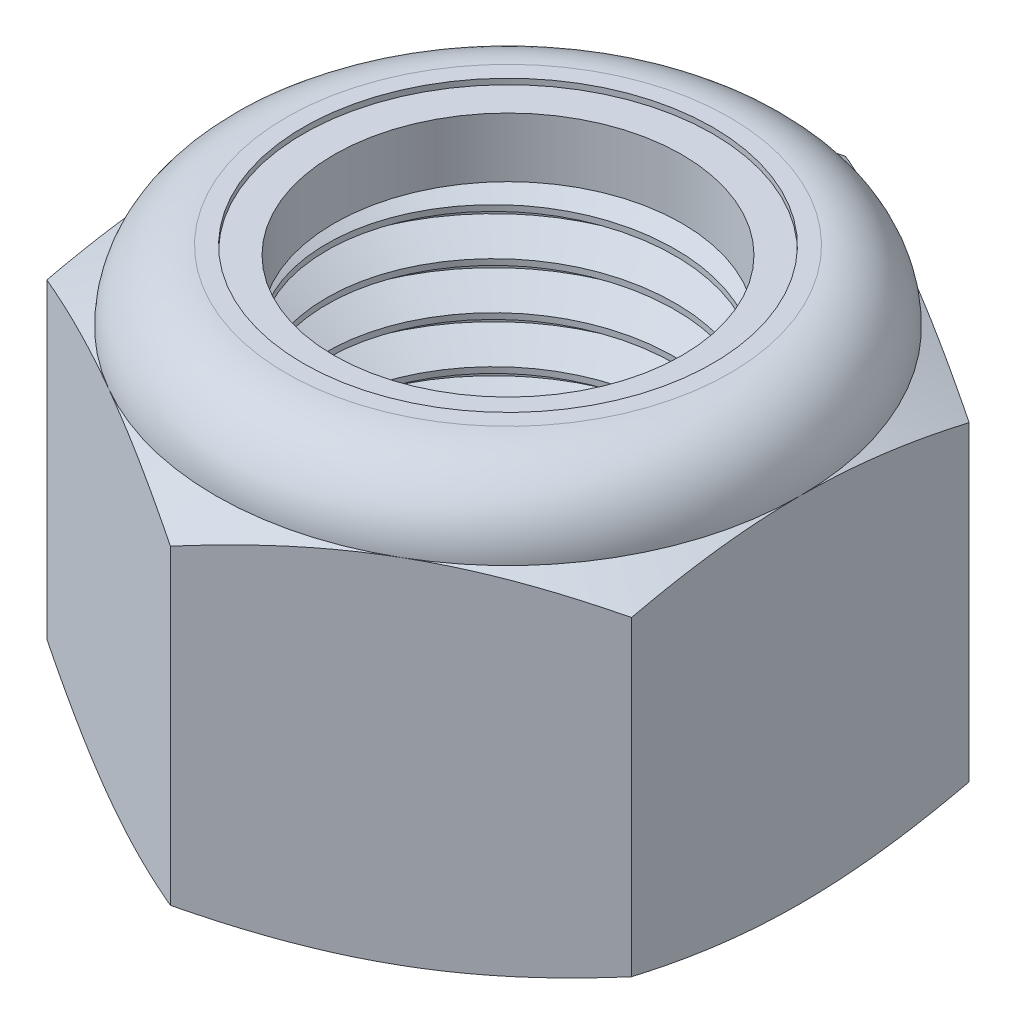
from build123d import *

# Parameters (mm, degrees)
SKETCH1_R        = 5.55625
EXTRUDE1_DEPTH   = 11.509375
SKETCH2_W        = 5.55625
SKETCH2_H        = 9.591145833
CUT_SWEEP1_PITCH = 1.27
SKETCH12_W       = 6.111875
SKETCH12_H       = 9.591145833


with BuildPart() as part:
    # Sketch1 → Extrude1 (new body)
    with BuildSketch(Plane(origin=(0, 0, 0), x_dir=(1, 0, 0), z_dir=(0, 1, 0))):
        Polygon((0, 9.165435523), (-7.9375, 4.582717762), (-7.9375, -4.582717762), (0, -9.165435523), (7.9375, -4.582717762), (7.9375, 4.582717762), align=None)
        with Locations(Location((0, 0, 0), (0, 0, 270))):
            Circle(SKETCH1_R, mode=Mode.SUBTRACT)
    extrude(amount=EXTRUDE1_DEPTH)

    # Sketch5 → Cut-Revolve3 (revolve, cut)
    with BuildSketch(Plane(origin=(0, 0, 0), x_dir=(0, 0, -1), z_dir=(1, 0, 0))):
        with BuildLine():
            Line((0, 0), (7.9375, 0))
            Line((7.9375, 0), (9.165435523, 0.572595738))
            Line((9.165435523, 0.572595738), (9.165435523, 9.018550095))
            Line((9.165435523, 9.018550095), (7.9375, 9.591145833))
            ThreePointArc((7.9375, 9.591145833), (7.375663685, 10.947538685), (6.019270833, 11.509375))
            Line((6.019270833, 11.509375), (6.019270833, 12.779375))
            Line((6.019270833, 12.779375), (10.435435523, 12.779375))
            Line((10.435435523, 12.779375), (10.435435523, -1.27))
            Line((10.435435523, -1.27), (0, -1.27))
            Line((0, -1.27), (0, 0))
        make_face()
    revolve(axis=Axis((0, 0, 0), (0, 1, 0)), mode=Mode.SUBTRACT)

    # Sketch6 → Cut-Revolve4 (revolve, cut)
    with BuildSketch(Plane(origin=(0, 0, 0), x_dir=(0, 0, -1), z_dir=(1, 0, 0)), mode=Mode.PRIVATE) as cut_revolve4_sk:
        with BuildLine():
            Line((0, 9.591145833), (7.7851, 9.591145833))
            ThreePointArc((7.7851, 9.591145833), (7.267900612, 10.839775612), (6.019270833, 11.356975))
            Line((6.019270833, 11.356975), (3.009635417, 11.356975))
            Line((3.009635417, 11.356975), (3.009635417, 12.779375))
            Line((3.009635417, 12.779375), (0, 12.779375))
            Line((0, 12.779375), (0, 9.591145833))
        make_face()
    revolve(cut_revolve4_sk.sketch.rotate(Axis((0, 12.779375, 0), (0, -1, 0)), 180), axis=Axis((0, 12.779375, 0), (0, -1, 0)), mode=Mode.SUBTRACT)

    # Sketch4 → Cut-Revolve2 (revolve, cut)
    with BuildSketch(Plane(origin=(0, 0, 0), x_dir=(0, 0, -1), z_dir=(1, 0, 0))):
        Polygon((0, 9.591145833), (6.111875, 9.591145833), (0, 6.741131715), align=None)
        Polygon((0, 2.850014118), (6.111875, 0), (0, 0), align=None)
    revolve(axis=Axis((0, 0, 0), (0, 1, 0)), mode=Mode.SUBTRACT)

    # Sketch12 → Revolve4 (revolve)
    with BuildSketch(Plane(origin=(0, 0, 0), x_dir=(0, 0, -1), z_dir=(1, 0, 0)), mode=Mode.PRIVATE) as revolve4_sk:
        with Locations((3.0559375, 4.795572917)):
            Rectangle(SKETCH12_W, SKETCH12_H)
    revolve(revolve4_sk.sketch.rotate(Axis((0, 0, 0), (0, 1, 0)), 279.919231996), axis=Axis((0, 0, 0), (0, 1, 0)))


with BuildPart() as body_2:
    # Sketch7 → Revolve2 (revolve)
    with BuildSketch(Plane(origin=(0, 0, 0), x_dir=(0, 0, -1), z_dir=(1, 0, 0))):
        with BuildLine():
            Line((4.7228125, 9.667345833), (7.707180867, 9.667345833))
            ThreePointArc((7.707180867, 9.667345833), (7.18676751, 10.812537757), (6.019270833, 11.280775))
            Line((6.019270833, 11.280775), (4.7228125, 11.280775))
            Line((4.7228125, 11.280775), (4.7228125, 9.667345833))
        make_face()
    revolve(axis=Axis((0, 9.667345833, 0), (0, 1, 0)))


with BuildPart() as body_3:
    # Sketch2 → Revolve1 (revolve)
    with BuildSketch(Plane(origin=(0, 0, 0), x_dir=(0, 0, -1), z_dir=(1, 0, 0))):
        with Locations((2.778125, 4.795572917)):
            Rectangle(SKETCH2_W, SKETCH2_H)
    revolve(axis=Axis((0, -5.55625, 0), (0, 1, 0)))

    # Cut-Sweep1: the profile of Sketch9 screwed along a right-hand helix of 10.0625 turns, 8 arcs to a turn; built about Z, then put on its axis
    cut_sweep1_z = Axis((0, 0, 0), (0, 0, 1))
    cut_sweep1_corners = [(5.693731533, 0, 0.079375), (5.624990766, 0, -1.1509375), (4.731360803, 0, -0.635), (4.731360803, 0, -0.47625)]
    with BuildLine(mode=Mode.PRIVATE) as cut_sweep1_profile:
        Line(cut_sweep1_corners[0], cut_sweep1_corners[1])
        Line(cut_sweep1_corners[1], cut_sweep1_corners[2])
        Line(cut_sweep1_corners[2], cut_sweep1_corners[3])
        Line(cut_sweep1_corners[3], cut_sweep1_corners[0])
    cut_sweep1_cap = Face(cut_sweep1_profile.wire())
    cut_sweep1_turn_angles = [0, 22.5, 45, 67.5, 90, 112.5, 135, 157.5, 180, 202.5, 225, 247.5, 270, 292.5, 315, 337.5, 360]
    cut_sweep1_turn_weights = [1, 0.9238795325112867, 1, 0.9238795325112867, 1, 0.9238795325112867, 1, 0.9238795325112867, 1, 0.9238795325112867, 1, 0.9238795325112867, 1, 0.9238795325112867, 1, 0.9238795325112867, 1]
    cut_sweep1_turn_rails = [Edge.make_bspline([Vector(p[0], p[1], 0).rotate(cut_sweep1_z, cut_sweep1_turn_angles[k]) / cut_sweep1_turn_weights[k] + Vector(0, 0, p[2] + CUT_SWEEP1_PITCH * cut_sweep1_turn_angles[k] / 360) for k in range(17)], [0, 0, 0, 1, 1, 2, 2, 3, 3, 4, 4, 5, 5, 6, 6, 7, 7, 8, 8, 8], 2, cut_sweep1_turn_weights) for p in cut_sweep1_corners]
    cut_sweep1_turn_sides = [Face.make_surface_from_curves(cut_sweep1_turn_rails[p[0]], cut_sweep1_turn_rails[p[1]]) for p in [(0, 1), (1, 2), (2, 3), (3, 0)]]
    cut_sweep1_last_angles = [3600, 3611.25, 3622.5]
    cut_sweep1_last_weights = [1, 0.9807852804031956, 1]
    cut_sweep1_last_rails = [Edge.make_bspline([Vector(p[0], p[1], 0).rotate(cut_sweep1_z, cut_sweep1_last_angles[k]) / cut_sweep1_last_weights[k] + Vector(0, 0, p[2] + CUT_SWEEP1_PITCH * cut_sweep1_last_angles[k] / 360) for k in range(3)], [0, 0, 0, 1, 1, 1], 2, cut_sweep1_last_weights) for p in cut_sweep1_corners]
    cut_sweep1_last_sides = [Face.make_surface_from_curves(cut_sweep1_last_rails[p[0]], cut_sweep1_last_rails[p[1]]) for p in [(0, 1), (1, 2), (2, 3), (3, 0)]]
    cut_sweep1 = Plane(origin=(0, 9.591145833, 0), x_dir=(0, 0, -1), z_dir=(0, -1, 0)) * Solid(Shell([*[p.moved(Location((0, 0, CUT_SWEEP1_PITCH * i))) for i in range(10) for p in cut_sweep1_turn_sides], *cut_sweep1_last_sides, cut_sweep1_cap, cut_sweep1_cap.rotate(cut_sweep1_z, 3622.5).moved(Location((0, 0, CUT_SWEEP1_PITCH * 3622.5 / 360)))]))
    add(cut_sweep1, mode=Mode.SUBTRACT)

    # Sketch11 → Revolve3 (revolve)
    with BuildSketch(Plane(origin=(0, 0, 0), x_dir=(0, 0, -1), z_dir=(1, 0, 0))):
        Polygon((0, 0), (6.111875, 0), (0, 2.850014118), align=None)
    revolve(axis=Axis((0, 11.509375, 0), (0, -1, 0)))


with BuildPart() as part_1:
    add(part.part)

    # Combine1: cut body 3
    add(body_3.part, mode=Mode.SUBTRACT)


solid = Compound([body_2.part, part_1.part])
